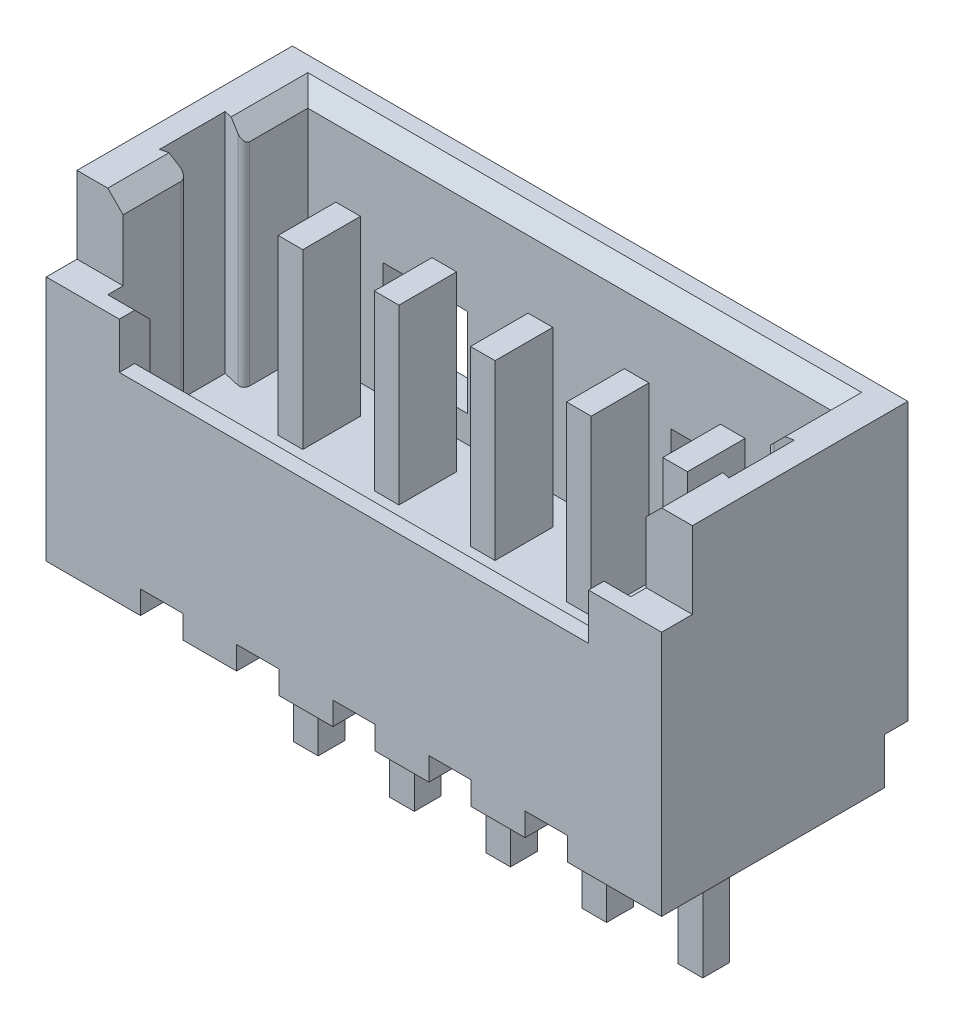
from build123d import *

# Parameters (mm, degrees)
SKETCH1_W            = 8
SKETCH1_H            = 4.2
BOSS_EXTRUDE1_DEPTH  = 2.8
CUT_EXTRUDE1_DEPTH   = 6.1
SKETCH3_W            = 0.95
SKETCH3_H            = 1
CUT_EXTRUDE2_DEPTH   = 0.4
CUT_EXTRUDE3_DEPTH   = 1
CUT_EXTRUDE4_DEPTH   = 0.35
CUT_EXTRUDE5_DEPTH   = 0.35
SKETCH7_W            = 8
SKETCH7_H            = 4.2
BOSS_EXTRUDE2_DEPTH  = 0.4
SKETCH8_W            = 0.55
SKETCH8_H            = 0.1
CUT_EXTRUDE6_DEPTH   = 3.2
CUT_EXTRUDE7_REACH   = 7.811
SKETCH10_W           = 0.55
SKETCH10_H           = 1.2
SKETCH11_W           = 0.55
SKETCH11_H           = 0.1
CUT_EXTRUDE8_DEPTH   = 3.2
CUT_EXTRUDE9_REACH   = 7.811
SKETCH13_W           = 0.55
SKETCH13_H           = 1.2
SKETCH14_W           = 0.55
SKETCH14_H           = 0.1
CUT_EXTRUDE10_DEPTH  = 3.2
CUT_EXTRUDE11_REACH  = 7.811
SKETCH16_W           = 0.55
SKETCH16_H           = 1.2
SKETCH17_W           = 0.55
SKETCH17_H           = 0.1
CUT_EXTRUDE12_DEPTH  = 3.2
CUT_EXTRUDE13_REACH  = 7.811
SKETCH19_W           = 0.55
SKETCH19_H           = 1.2
SKETCH20_W           = 0.55
SKETCH20_H           = 0.1
CUT_EXTRUDE14_DEPTH  = 3.2
CUT_EXTRUDE15_REACH  = 7.811
SKETCH22_W           = 0.55
SKETCH22_H           = 1.2
CUT_EXTRUDE16_REACH  = 7.614
SKETCH24_W           = 0.55
SKETCH24_H           = 0.3
CUT_EXTRUDE17_REACH  = 7.614
SKETCH26_W           = 0.55
SKETCH26_H           = 0.3
CUT_EXTRUDE18_REACH  = 7.614
SKETCH28_W           = 0.55
SKETCH28_H           = 0.3
CUT_EXTRUDE19_REACH  = 7.614
SKETCH30_W           = 0.55
SKETCH30_H           = 0.3
CUT_EXTRUDE20_REACH  = 7.614
SKETCH32_W           = 0.55
SKETCH32_H           = 0.3
CUT_EXTRUDE21_DEPTH  = 2.95
SKETCH34_W           = 0.3
SKETCH34_H           = 0.853669018
CUT_EXTRUDE22_DEPTH  = 2.95
SKETCH35_W           = 1.1
SKETCH35_H           = 1.15
CUT_EXTRUDE23_DEPTH  = 6.85154894
CUT_EXTRUDE24_REACH  = 8.053
SKETCH36_W           = 1.1
SKETCH36_H           = 1.15
SKETCH37_W           = 0.575
SKETCH37_H           = 0.3
CUT_EXTRUDE25_DEPTH  = 0.6
SKETCH38_W           = 0.3
SKETCH38_H           = 0.6
CUT_EXTRUDE26_DEPTH  = 0.575
SKETCH39_W           = 0.32
SKETCH39_H           = 0.35
BOSS_EXTRUDE3_DEPTH  = 2.4
SKETCH40_W           = 0.32
SKETCH40_H           = 0.35
BOSS_EXTRUDE4_DEPTH  = 2.4
SKETCH41_W           = 0.32
SKETCH41_H           = 0.35
BOSS_EXTRUDE5_DEPTH  = 2.4
SKETCH42_W           = 0.32
SKETCH42_H           = 0.35
BOSS_EXTRUDE6_DEPTH  = 2.4
SKETCH43_W           = 0.32
SKETCH43_H           = 0.35
BOSS_EXTRUDE7_DEPTH  = 2.4
SKETCH44_W           = 0.32
SKETCH44_H           = 0.75
BOSS_EXTRUDE8_DEPTH  = 2.25
SKETCH45_W           = 0.32
SKETCH45_H           = 0.75
BOSS_EXTRUDE9_DEPTH  = 2.25
SKETCH46_W           = 0.32
SKETCH46_H           = 0.75
BOSS_EXTRUDE10_DEPTH = 2.25
SKETCH47_W           = 0.32
SKETCH47_H           = 0.75
BOSS_EXTRUDE11_DEPTH = 2.25
SKETCH48_W           = 0.32
SKETCH48_H           = 0.75
BOSS_EXTRUDE12_DEPTH = 2.25
DRAFT1_ANGLE         = -13.146241157
DRAFT2_ANGLE         = -13.146241157
FILLET1_R            = 0.07
CHAMFER1_SIZE        = 0.2


with BuildPart() as part:
    # Sketch1 → Boss-Extrude1 (new body)
    with BuildSketch(Plane.XY.offset(1.6)):
        with Locations((0, -1.125)):
            Rectangle(SKETCH1_W, SKETCH1_H)
    extrude(amount=-BOSS_EXTRUDE1_DEPTH)

    # Sketch2 → Cut-Extrude1 (cut)
    with BuildSketch(Plane(origin=(3.05, 0, 0), x_dir=(0, 0, -1), z_dir=(1, 0, 0))):
        Polygon((1.2, 0.975), (-1.6, 0.975), (-1.6, -0.625), (-1.4, -0.625), (-1.2, -0.825), (-1.2, -1.975), (1.2, -1.975), align=None)
    extrude(amount=-CUT_EXTRUDE1_DEPTH, mode=Mode.SUBTRACT)

    # Sketch3 → Cut-Extrude2 (cut)
    with BuildSketch(Plane.XY.offset(1.6)):
        with Locations((3.525, 0.475)):
            Rectangle(SKETCH3_W, SKETCH3_H)
    extrude(amount=-CUT_EXTRUDE2_DEPTH, mode=Mode.SUBTRACT)

    # Sketch4 → Cut-Extrude3 (cut)
    with BuildSketch(Plane(origin=(0, 0.975, 0), x_dir=(-1, 0, 0), z_dir=(0, 1, 0))):
        with BuildLine():
            Line((3.05, 1.6), (3.05, 1.2))
            add(Edge.make_bspline(
                [(3.05, 1.2), (3.166666667, 1.2), (3.283333333, 1.2), (3.4, 1.2)],
                knots=[0, 0, 0, 0, 1, 1, 1, 1], degree=3))
            Line((3.4, 1.2), (4, 1.2))
            Line((4, 1.2), (4, 1.6))
            Line((4, 1.6), (3.05, 1.6))
        make_face()
    extrude(amount=-CUT_EXTRUDE3_DEPTH, mode=Mode.SUBTRACT)

    # Sketch5 → Cut-Extrude4 (cut)
    with BuildSketch(Plane.ZY.offset(-3.05)):
        Polygon((-1.2, -1.975), (1.2, -1.975), (1.2, -0.225), (1.4, -0.025), (1.2, -0.025), (1.2, 0.975), (-1.2, 0.975), align=None)
    extrude(amount=-CUT_EXTRUDE4_DEPTH, mode=Mode.SUBTRACT)

    # Sketch6 → Cut-Extrude5 (cut)
    with BuildSketch(Plane(origin=(-3.05, 0, 0), x_dir=(0, 0, -1), z_dir=(1, 0, 0))):
        Polygon((1.2, -1.975), (1.2, 0.975), (-1.2, 0.975), (-1.2, -0.025), (-1.4, -0.025), (-1.2, -0.225), (-1.2, -1.975), align=None)
    extrude(amount=-CUT_EXTRUDE5_DEPTH, mode=Mode.SUBTRACT)

    # Sketch7 → Boss-Extrude2 (add)
    with BuildSketch(Plane(origin=(0, 0, -1.2), x_dir=(-1, 0, 0), z_dir=(0, 0, -1))):
        with Locations((0, -1.125)):
            Rectangle(SKETCH7_W, SKETCH7_H)
    extrude(amount=BOSS_EXTRUDE2_DEPTH)

    # Sketch8 → Cut-Extrude6 (cut)
    with BuildSketch(Plane.XY.offset(1.6)):
        with Locations((-1.25, -3.175)):
            Rectangle(SKETCH8_W, SKETCH8_H)
    extrude(amount=-CUT_EXTRUDE6_DEPTH, mode=Mode.SUBTRACT)

    # Sketch10 → Cut-Extrude7 (cut, up to next)
    with BuildSketch(Plane(origin=(0, -2.925, 0), x_dir=(1, 0, 0), z_dir=(0, 1, 0)), mode=Mode.PRIVATE) as cut_extrude7_sk1:
        with Locations((-1.25, -1)):
            Rectangle(SKETCH10_W, SKETCH10_H)
    cut_extrude7_tool1 = extrude(cut_extrude7_sk1.sketch, amount=-CUT_EXTRUDE7_REACH, mode=Mode.PRIVATE) & part.part
    add(cut_extrude7_tool1.solids().sort_by_distance((-1.25, -2.925, 1))[0], mode=Mode.SUBTRACT)

    # Sketch11 → Cut-Extrude8 (cut)
    with BuildSketch(Plane.XY.offset(1.6)):
        with Locations((0, -3.175)):
            Rectangle(SKETCH11_W, SKETCH11_H)
    extrude(amount=-CUT_EXTRUDE8_DEPTH, mode=Mode.SUBTRACT)

    # Sketch13 → Cut-Extrude9 (cut, up to next)
    with BuildSketch(Plane(origin=(0, -2.925, 0), x_dir=(1, 0, 0), z_dir=(0, 1, 0)), mode=Mode.PRIVATE) as cut_extrude9_sk1:
        with Locations((0, -1)):
            Rectangle(SKETCH13_W, SKETCH13_H)
    cut_extrude9_tool1 = extrude(cut_extrude9_sk1.sketch, amount=-CUT_EXTRUDE9_REACH, mode=Mode.PRIVATE) & part.part
    add(cut_extrude9_tool1.solids().sort_by_distance((0, -2.925, 1))[0], mode=Mode.SUBTRACT)

    # Sketch14 → Cut-Extrude10 (cut)
    with BuildSketch(Plane.XY.offset(1.6)):
        with Locations((1.25, -3.175)):
            Rectangle(SKETCH14_W, SKETCH14_H)
    extrude(amount=-CUT_EXTRUDE10_DEPTH, mode=Mode.SUBTRACT)

    # Sketch16 → Cut-Extrude11 (cut, up to next)
    with BuildSketch(Plane(origin=(0, -2.925, 0), x_dir=(1, 0, 0), z_dir=(0, 1, 0)), mode=Mode.PRIVATE) as cut_extrude11_sk1:
        with Locations((1.25, -1)):
            Rectangle(SKETCH16_W, SKETCH16_H)
    cut_extrude11_tool1 = extrude(cut_extrude11_sk1.sketch, amount=-CUT_EXTRUDE11_REACH, mode=Mode.PRIVATE) & part.part
    add(cut_extrude11_tool1.solids().sort_by_distance((1.25, -2.925, 1))[0], mode=Mode.SUBTRACT)

    # Sketch17 → Cut-Extrude12 (cut)
    with BuildSketch(Plane.XY.offset(1.6)):
        with Locations((2.5, -3.175)):
            Rectangle(SKETCH17_W, SKETCH17_H)
    extrude(amount=-CUT_EXTRUDE12_DEPTH, mode=Mode.SUBTRACT)

    # Sketch19 → Cut-Extrude13 (cut, up to next)
    with BuildSketch(Plane(origin=(0, -2.925, 0), x_dir=(1, 0, 0), z_dir=(0, 1, 0)), mode=Mode.PRIVATE) as cut_extrude13_sk1:
        with Locations((2.5, -1)):
            Rectangle(SKETCH19_W, SKETCH19_H)
    cut_extrude13_tool1 = extrude(cut_extrude13_sk1.sketch, amount=-CUT_EXTRUDE13_REACH, mode=Mode.PRIVATE) & part.part
    add(cut_extrude13_tool1.solids().sort_by_distance((2.5, -2.925, 1))[0], mode=Mode.SUBTRACT)

    # Sketch20 → Cut-Extrude14 (cut)
    with BuildSketch(Plane.XY.offset(1.6)):
        with Locations((-2.5, -3.175)):
            Rectangle(SKETCH20_W, SKETCH20_H)
    extrude(amount=-CUT_EXTRUDE14_DEPTH, mode=Mode.SUBTRACT)

    # Sketch22 → Cut-Extrude15 (cut, up to next)
    with BuildSketch(Plane(origin=(0, -2.925, 0), x_dir=(1, 0, 0), z_dir=(0, 1, 0)), mode=Mode.PRIVATE) as cut_extrude15_sk1:
        with Locations((-2.5, -1)):
            Rectangle(SKETCH22_W, SKETCH22_H)
    cut_extrude15_tool1 = extrude(cut_extrude15_sk1.sketch, amount=-CUT_EXTRUDE15_REACH, mode=Mode.PRIVATE) & part.part
    add(cut_extrude15_tool1.solids().sort_by_distance((-2.5, -2.925, 1))[0], mode=Mode.SUBTRACT)

    # Sketch24 → Cut-Extrude16 (cut, up to next)
    with BuildSketch(Plane(origin=(0, -2.625, 0), x_dir=(1, 0, 0), z_dir=(0, 1, 0)), mode=Mode.PRIVATE) as cut_extrude16_sk1:
        with Locations((-2.5, 1.45)):
            Rectangle(SKETCH24_W, SKETCH24_H)
    cut_extrude16_tool1 = extrude(cut_extrude16_sk1.sketch, amount=-CUT_EXTRUDE16_REACH, mode=Mode.PRIVATE) & part.part
    add(cut_extrude16_tool1.solids().sort_by_distance((-2.5, -2.625, -1.45))[0], mode=Mode.SUBTRACT)

    # Sketch26 → Cut-Extrude17 (cut, up to next)
    with BuildSketch(Plane(origin=(0, -2.625, 0), x_dir=(1, 0, 0), z_dir=(0, 1, 0)), mode=Mode.PRIVATE) as cut_extrude17_sk1:
        with Locations((2.5, 1.45)):
            Rectangle(SKETCH26_W, SKETCH26_H)
    cut_extrude17_tool1 = extrude(cut_extrude17_sk1.sketch, amount=-CUT_EXTRUDE17_REACH, mode=Mode.PRIVATE) & part.part
    add(cut_extrude17_tool1.solids().sort_by_distance((2.5, -2.625, -1.45))[0], mode=Mode.SUBTRACT)

    # Sketch28 → Cut-Extrude18 (cut, up to next)
    with BuildSketch(Plane(origin=(0, -2.625, 0), x_dir=(1, 0, 0), z_dir=(0, 1, 0)), mode=Mode.PRIVATE) as cut_extrude18_sk1:
        with Locations((1.25, 1.45)):
            Rectangle(SKETCH28_W, SKETCH28_H)
    cut_extrude18_tool1 = extrude(cut_extrude18_sk1.sketch, amount=-CUT_EXTRUDE18_REACH, mode=Mode.PRIVATE) & part.part
    add(cut_extrude18_tool1.solids().sort_by_distance((1.25, -2.625, -1.45))[0], mode=Mode.SUBTRACT)

    # Sketch30 → Cut-Extrude19 (cut, up to next)
    with BuildSketch(Plane(origin=(0, -2.625, 0), x_dir=(1, 0, 0), z_dir=(0, 1, 0)), mode=Mode.PRIVATE) as cut_extrude19_sk1:
        with Locations((0, 1.45)):
            Rectangle(SKETCH30_W, SKETCH30_H)
    cut_extrude19_tool1 = extrude(cut_extrude19_sk1.sketch, amount=-CUT_EXTRUDE19_REACH, mode=Mode.PRIVATE) & part.part
    add(cut_extrude19_tool1.solids().sort_by_distance((0, -2.625, -1.45))[0], mode=Mode.SUBTRACT)

    # Sketch32 → Cut-Extrude20 (cut, up to next)
    with BuildSketch(Plane(origin=(0, -2.625, 0), x_dir=(1, 0, 0), z_dir=(0, 1, 0)), mode=Mode.PRIVATE) as cut_extrude20_sk1:
        with Locations((-1.25, 1.45)):
            Rectangle(SKETCH32_W, SKETCH32_H)
    cut_extrude20_tool1 = extrude(cut_extrude20_sk1.sketch, amount=-CUT_EXTRUDE20_REACH, mode=Mode.PRIVATE) & part.part
    add(cut_extrude20_tool1.solids().sort_by_distance((-1.25, -2.625, -1.45))[0], mode=Mode.SUBTRACT)

    # Sketch33 → Cut-Extrude21 (cut)
    with BuildSketch(Plane(origin=(0, 0.975, 0), x_dir=(-1, 0, 0), z_dir=(0, 1, 0))):
        Polygon((3.7, -0.356767045), (3.7, 0.426834509), (3.4, 0.356767045), (3.4, -0.356767045), align=None)
    extrude(amount=-CUT_EXTRUDE21_DEPTH, mode=Mode.SUBTRACT)

    # Sketch34 → Cut-Extrude22 (cut)
    with BuildSketch(Plane(origin=(0, 0.975, 0), x_dir=(-1, 0, 0), z_dir=(0, 1, 0))):
        with Locations((-3.55, 0)):
            Rectangle(SKETCH34_W, SKETCH34_H)
    extrude(amount=-CUT_EXTRUDE22_DEPTH, mode=Mode.SUBTRACT)

    # Sketch35 → Cut-Extrude23 (cut, through all)
    with BuildSketch(Plane.XY.offset(-1.2)):
        with Locations((-1.875, -1.05)):
            Rectangle(SKETCH35_W, SKETCH35_H)
    extrude(amount=-CUT_EXTRUDE23_DEPTH, mode=Mode.SUBTRACT)

    # Sketch36 → Cut-Extrude24 (cut, up to next)
    with BuildSketch(Plane(origin=(0, 0, -1.6), x_dir=(-1, 0, 0), z_dir=(0, 0, -1)), mode=Mode.PRIVATE) as cut_extrude24_sk1:
        with Locations((-1.875, -1.05)):
            Rectangle(SKETCH36_W, SKETCH36_H)
    cut_extrude24_tool1 = extrude(cut_extrude24_sk1.sketch, amount=-CUT_EXTRUDE24_REACH, mode=Mode.PRIVATE) & part.part
    add(cut_extrude24_tool1.solids().sort_by_distance((1.875, -1.05, -1.6))[0], mode=Mode.SUBTRACT)

    # Sketch37 → Cut-Extrude25 (cut)
    with BuildSketch(Plane.XZ.offset(3.225)):
        with Locations((-3.7125, -1.45)):
            Rectangle(SKETCH37_W, SKETCH37_H)
    extrude(amount=-CUT_EXTRUDE25_DEPTH, mode=Mode.SUBTRACT)

    # Sketch38 → Cut-Extrude26 (cut)
    with BuildSketch(Plane(origin=(4, 0, 0), x_dir=(0, 0, -1), z_dir=(1, 0, 0))):
        with Locations((1.45, -2.925)):
            Rectangle(SKETCH38_W, SKETCH38_H)
    extrude(amount=-CUT_EXTRUDE26_DEPTH, mode=Mode.SUBTRACT)

    # Sketch39 → Boss-Extrude3 (add)
    with BuildSketch(Plane.XZ.offset(3.125)):
        with Locations((1.25, -0.45)):
            Rectangle(SKETCH39_W, SKETCH39_H)
    extrude(amount=BOSS_EXTRUDE3_DEPTH)

    # Sketch40 → Boss-Extrude4 (add)
    with BuildSketch(Plane.XZ.offset(3.125)):
        with Locations((0, -0.45)):
            Rectangle(SKETCH40_W, SKETCH40_H)
    extrude(amount=BOSS_EXTRUDE4_DEPTH)

    # Sketch41 → Boss-Extrude5 (add)
    with BuildSketch(Plane.XZ.offset(3.125)):
        with Locations((-1.25, -0.45)):
            Rectangle(SKETCH41_W, SKETCH41_H)
    extrude(amount=BOSS_EXTRUDE5_DEPTH)

    # Sketch42 → Boss-Extrude6 (add)
    with BuildSketch(Plane.XZ.offset(3.125)):
        with Locations((-2.5, -0.45)):
            Rectangle(SKETCH42_W, SKETCH42_H)
    extrude(amount=BOSS_EXTRUDE6_DEPTH)

    # Sketch43 → Boss-Extrude7 (add)
    with BuildSketch(Plane.XZ.offset(3.125)):
        with Locations((2.5, -0.45)):
            Rectangle(SKETCH43_W, SKETCH43_H)
    extrude(amount=BOSS_EXTRUDE7_DEPTH)

    # Sketch44 → Boss-Extrude8 (add)
    with BuildSketch(Plane(origin=(0, -1.975, 0), x_dir=(-1, 0, 0), z_dir=(0, 1, 0))):
        with Locations((-2.5, -0.45)):
            Rectangle(SKETCH44_W, SKETCH44_H)
    extrude(amount=BOSS_EXTRUDE8_DEPTH)

    # Sketch45 → Boss-Extrude9 (add)
    with BuildSketch(Plane(origin=(0, -1.975, 0), x_dir=(-1, 0, 0), z_dir=(0, 1, 0))):
        with Locations((-1.25, -0.45)):
            Rectangle(SKETCH45_W, SKETCH45_H)
    extrude(amount=BOSS_EXTRUDE9_DEPTH)

    # Sketch46 → Boss-Extrude10 (add)
    with BuildSketch(Plane(origin=(0, -1.975, 0), x_dir=(-1, 0, 0), z_dir=(0, 1, 0))):
        with Locations((0, -0.45)):
            Rectangle(SKETCH46_W, SKETCH46_H)
    extrude(amount=BOSS_EXTRUDE10_DEPTH)

    # Sketch47 → Boss-Extrude11 (add)
    with BuildSketch(Plane(origin=(0, -1.975, 0), x_dir=(-1, 0, 0), z_dir=(0, 1, 0))):
        with Locations((1.25, -0.45)):
            Rectangle(SKETCH47_W, SKETCH47_H)
    extrude(amount=BOSS_EXTRUDE11_DEPTH)

    # Sketch48 → Boss-Extrude12 (add)
    with BuildSketch(Plane(origin=(0, -1.975, 0), x_dir=(-1, 0, 0), z_dir=(0, 1, 0))):
        with Locations((2.5, -0.45)):
            Rectangle(SKETCH48_W, SKETCH48_H)
    extrude(amount=BOSS_EXTRUDE12_DEPTH)

    # Draft1
    draft1_faces = [part.faces().sort_by_distance(p)[0] for p in [
        (-3.55, -0.5, -0.356767045),
    ]]
    draft(draft1_faces, Plane(origin=(-3.4, 0, 0), x_dir=(0, 0, 1), z_dir=(1, 0, 0)), DRAFT1_ANGLE)

    # Draft2
    draft2_faces = [part.faces().sort_by_distance(p)[0] for p in [
        (3.55, -0.5, -0.426834509),
        (3.55, -0.5, 0.426834509),
    ]]
    draft(draft2_faces, Plane(origin=(3.7, -1.975, 0.426834509), x_dir=(0, 0, -1), z_dir=(-1, 0, 0)), DRAFT2_ANGLE)

    # Fillet1
    fillet1_edges = [part.edges().sort_by_distance(p)[0] for p in [
        (-3.4, -0.5, -0.356767045),
        (-3.4, -0.5, 0.356767045),
        (3.4, -0.5, -0.356767045),
        (3.4, -0.5, 0.356767045),
    ]]
    fillet(fillet1_edges, radius=FILLET1_R)

    # Chamfer1
    # the kernel refuses this chamfer: 0.2 mm, written as the material it takes off along each edge
    with BuildSketch(Plane(origin=(3.4, 0.975, 1.714336598), x_dir=(0.9996219169112966, 0.02749587661058616, 0), z_dir=(0, 0, -1)), Plane(origin=(-3.4, 0.975, -0.069336598), x_dir=(-0.9996219169112968, 0.027495876610586105, 0), z_dir=(0, 0, 1))) as chamfer1_piece_1:
        Polygon((CHAMFER1_SIZE * 0.999621916911, CHAMFER1_SIZE * 0.0274958766106), (-CHAMFER1_SIZE * 0.0274958766106, CHAMFER1_SIZE * 0.999621916911), (0, 0), align=None)
    extrude(amount=1.783673195, mode=Mode.SUBTRACT)
    with BuildSketch(Plane(origin=(3.4, 0.975, 0.069336598), x_dir=(0.9996219169112966, 0.02749587661058616, 0), z_dir=(0, 0, -1)), Plane(origin=(-3.4, 0.975, -1.2), x_dir=(-0.9996219169112966, 0.02749587661058616, 0), z_dir=(0, 0, 1))) as chamfer1_piece_2:
        Polygon((CHAMFER1_SIZE * 0.999621916911, CHAMFER1_SIZE * 0.0274958766106), (-CHAMFER1_SIZE * 0.0274958766106, CHAMFER1_SIZE * 0.999621916911), (0, 0), align=None)
    extrude(amount=1.269336598, mode=Mode.SUBTRACT)
    with BuildSketch(Plane(origin=(3.4, 0.975, -1.2), x_dir=(0, 0.027495876610586223, -0.9996219169112966), z_dir=(-1, 0, 0))) as chamfer1_piece_3:
        Polygon((CHAMFER1_SIZE * 0.999621916911, CHAMFER1_SIZE * 0.0274958766106), (-CHAMFER1_SIZE * 0.0274958766106, CHAMFER1_SIZE * 0.999621916911), (0, 0), align=None)
    extrude(amount=6.8, mode=Mode.SUBTRACT)
    with BuildSketch(Plane(origin=(3.4, 0.975, 0.069336598), x_dir=(0.9996219169112966, 0.02749587661058616, 0), z_dir=(0, 0, -1))) as chamfer1_piece_4a_section:
        Polygon((CHAMFER1_SIZE * 0.999621916911, CHAMFER1_SIZE * 0.0274958766106), (-CHAMFER1_SIZE * 0.0274958766106, CHAMFER1_SIZE * 0.999621916911), (0, 0), align=None)
    chamfer1_piece_4a = extrude(amount=1.783673195, mode=Mode.PRIVATE)
    chamfer1_piece_4a = split(chamfer1_piece_4a, bisect_by=Plane(origin=(3.465958725, 0.909041275, -1.2), z_dir=(0, 0, -1)), keep=Keep.TOP, mode=Mode.PRIVATE)
    with BuildSketch(Plane(origin=(3.914336598, 0.975, -1.2), x_dir=(0, 0.02749587661058619, -0.9996219169112966), z_dir=(-1, 0, 0))) as chamfer1_piece_4b_section:
        Polygon((CHAMFER1_SIZE * 0.999621916911, CHAMFER1_SIZE * 0.0274958766106), (-CHAMFER1_SIZE * 0.0274958766106, CHAMFER1_SIZE * 0.999621916911), (0, 0), align=None)
    chamfer1_piece_4b = extrude(amount=7.314336598, mode=Mode.PRIVATE)
    chamfer1_piece_4b = split(chamfer1_piece_4b, bisect_by=Plane(origin=(3.4, 0.909041275, -1.265958725), z_dir=(1, 0, 0)), keep=Keep.TOP, mode=Mode.PRIVATE)
    chamfer1_piece_4 = chamfer1_piece_4a & chamfer1_piece_4b
    add(chamfer1_piece_4, mode=Mode.SUBTRACT)
    with BuildSketch(Plane(origin=(3.4, 0.975, -1.2), x_dir=(0, 0.027495876610586223, -0.9996219169112966), z_dir=(-1, 0, 0))) as chamfer1_piece_5a_section:
        Polygon((CHAMFER1_SIZE * 0.999621916911, CHAMFER1_SIZE * 0.0274958766106), (-CHAMFER1_SIZE * 0.0274958766106, CHAMFER1_SIZE * 0.999621916911), (0, 0), align=None)
    chamfer1_piece_5a = extrude(amount=7.314336598, mode=Mode.PRIVATE)
    chamfer1_piece_5a = split(chamfer1_piece_5a, bisect_by=Plane(origin=(-3.4, 0.909041275, -1.265958725), z_dir=(-1, 0, 0)), keep=Keep.TOP, mode=Mode.PRIVATE)
    with BuildSketch(Plane(origin=(-3.4, 0.975, -1.714336598), x_dir=(-0.9996219169112968, 0.027495876610586105, 0), z_dir=(0, 0, 1))) as chamfer1_piece_5b_section:
        Polygon((CHAMFER1_SIZE * 0.999621916911, CHAMFER1_SIZE * 0.0274958766106), (-CHAMFER1_SIZE * 0.0274958766106, CHAMFER1_SIZE * 0.999621916911), (0, 0), align=None)
    chamfer1_piece_5b = extrude(amount=1.783673195, mode=Mode.PRIVATE)
    chamfer1_piece_5b = split(chamfer1_piece_5b, bisect_by=Plane(origin=(-3.465958725, 0.909041275, -1.2), z_dir=(0, 0, -1)), keep=Keep.TOP, mode=Mode.PRIVATE)
    chamfer1_piece_5 = chamfer1_piece_5a & chamfer1_piece_5b
    add(chamfer1_piece_5, mode=Mode.SUBTRACT)


solid = part.part
